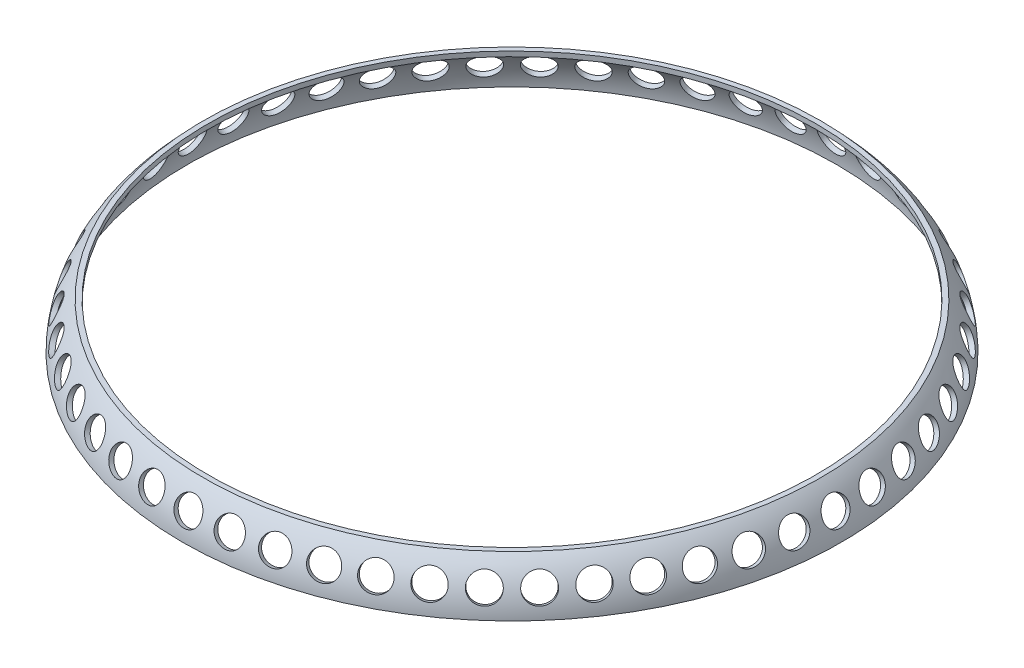
from build123d import *

# Parameters (mm, degrees)
SKETCH3_R          = 3
CUT_EXTRUDE1_DEPTH = 105.584702514
CIRPATTERN1_COUNT  = 52


with BuildPart() as part:
    # Sketch1 → Revolve1 (revolve)
    with BuildSketch(Plane.XY):
        with BuildLine():
            Line((69, 10.2), (67.9, 10.2))
            Line((67.9, 10.2), (67.9, 9.1))
            Line((67.9, 9.1), (69, 9.1))
            ThreePointArc((69, 9.1), (71.509993209, 4.84230508), (72.5, 0))
            Line((72.5, 0), (73.6, 0))
            ThreePointArc((73.6, 0), (72.286688071, 5.544976973), (69, 10.2))
        make_face()
    revolve(axis=Axis((0, 0, 0), (0, 1, 0)))

    # Sketch3 → Cut-Extrude1 (cut, through all)
    with BuildSketch(Plane(origin=(0, 0, 0), x_dir=(0, 0, 1), z_dir=(-0.9396926207859094, 0.34202014332566616, 0))):
        with Locations((0, -19.672682549)):
            Circle(SKETCH3_R)
    cut_extrude1 = extrude(amount=CUT_EXTRUDE1_DEPTH, mode=Mode.SUBTRACT)

    # CirPattern1: Cut-Extrude1 ×52 about axis
    cirpattern1_axis = Axis((0, 10.2, 0), (0, -1, 0))
    for i in range(1, CIRPATTERN1_COUNT):
        add(cut_extrude1.rotate(cirpattern1_axis, i * 360 / CIRPATTERN1_COUNT), mode=Mode.SUBTRACT)


solid = part.part
